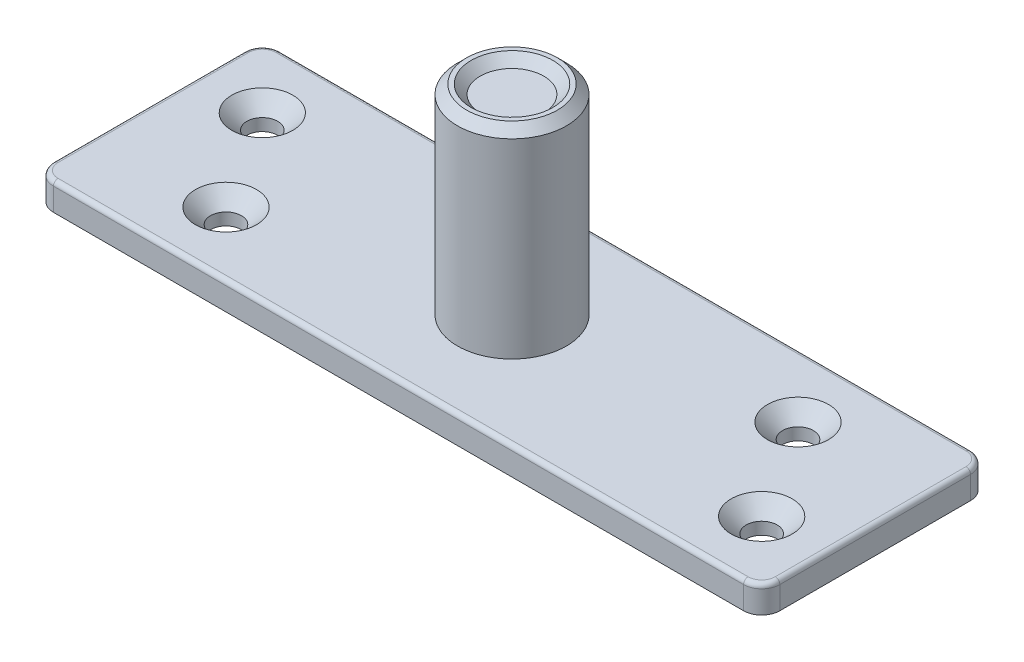
from build123d import *

# Parameters (mm, degrees)
ESBO_O1_W                           = 80
ESBO_O1_H                           = 25
ESBO_O1_R                           = 6
RESSALTO_EXTRUS_O1_DEPTH            = 1.5
ESBO_O3_R                           = 6
RESSALTO_EXTRUS_O3_DEPTH            = 25
CHANFRO1_SIZE                       = 1
ESCAREADO_PARA_SFHCS_M31_AT_2_COUNT = 2
ESCAREADO_PARA_SFHCS_M31_AT_2_PITCH = 13.03840481
ESCAREADO_PARA_SFHCS_M31_AT_3_COUNT = 2
ESCAREADO_PARA_SFHCS_M31_AT_3_PITCH = 59
ESCAREADO_PARA_SFHCS_M31_AT_4_COUNT = 2
ESCAREADO_PARA_SFHCS_M31_AT_4_PITCH = 66.910387833
FILETE1_R                           = 2
FILETE2_R                           = 0.5
ESBO_O7_R                           = 4.5
CORTE_EXTRUS_O1_DEPTH               = 1
CHANFRO2_SIZE                       = 1


with BuildPart() as part:
    # Esboço1 → Ressalto-extrusão1 (new, symmetric)
    with BuildSketch(Plane(origin=(0, 0, 0), x_dir=(1, 0, 0), z_dir=(0, 1, 0))):
        Rectangle(ESBO_O1_W, ESBO_O1_H)
        with Locations(Location((0, 0, 0), (0, 0, 270))):
            Circle(ESBO_O1_R, mode=Mode.SUBTRACT)
    extrude(amount=RESSALTO_EXTRUS_O1_DEPTH, both=True)

    # Esboço6 → Escareado para SFHCS M31 (revolve, cut)
    with BuildSketch(Plane(origin=(-33, 1.5, -5.5), x_dir=(0, 0, 1), z_dir=(1, 0, 0))):
        Polygon((0, 0), (0, 3), (1.7, 3), (1.7, 1.66), (3.36, 0), align=None)
    escareado_para_sfhcs_m31 = revolve(axis=Axis((-33, 7.85, -5.5), (0, -1, 0)), mode=Mode.SUBTRACT)

    # Escareado para SFHCS M31 at 2: Escareado para SFHCS M31 ×2
    with Locations(*[Vector(0.5368754921931594, 0, 0.8436614877321075) * (i * ESCAREADO_PARA_SFHCS_M31_AT_2_PITCH) for i in range(1, ESCAREADO_PARA_SFHCS_M31_AT_2_COUNT)]):
        add(escareado_para_sfhcs_m31, mode=Mode.SUBTRACT)

    # Escareado para SFHCS M31 at 3: Escareado para SFHCS M31 ×2
    with Locations(*[(i * ESCAREADO_PARA_SFHCS_M31_AT_3_PITCH, 0, 0) for i in range(1, ESCAREADO_PARA_SFHCS_M31_AT_3_COUNT)]):
        add(escareado_para_sfhcs_m31, mode=Mode.SUBTRACT)

    # Escareado para SFHCS M31 at 4: Escareado para SFHCS M31 ×2
    with Locations(*[Vector(0.9863939238321439, 0, 0.16439898730535732) * (i * ESCAREADO_PARA_SFHCS_M31_AT_4_PITCH) for i in range(1, ESCAREADO_PARA_SFHCS_M31_AT_4_COUNT)]):
        add(escareado_para_sfhcs_m31, mode=Mode.SUBTRACT)

    # Filete1
    filete1_edges = [part.edges().sort_by_distance(p)[0] for p in [
        (40, 0, 12.5),
        (-40, 0, 12.5),
        (-40, 0, -12.5),
        (40, 0, -12.5),
    ]]
    fillet(filete1_edges, radius=FILETE1_R)

    # Filete2
    filete2_edges = [part.edges().sort_by_distance(p)[0] for p in [
        (0, 1.5, -12.5),
        (40, 1.5, 0),
        (-40, 1.5, 0),
        (0, 1.5, 12.5),
        (-39.414213562, 1.5, 11.914213562),
        (-39.414213562, 1.5, -11.914213562),
        (39.414213562, 1.5, 11.914213562),
        (39.414213562, 1.5, -11.914213562),
    ]]
    fillet(filete2_edges, radius=FILETE2_R)


with BuildPart() as body_2:
    # Esboço3 → Ressalto-extrusão3 (new body)
    with BuildSketch(Plane.XZ.offset(1.5)):
        with Locations(Location((0, 0, 0), (0, 0, 270))):
            Circle(ESBO_O3_R)
    extrude(amount=-RESSALTO_EXTRUS_O3_DEPTH)

    # Chanfro1
    chanfro1_edges = [body_2.edges().sort_by_distance(p)[0] for p in [
        (0, -1.5, 6),
        (0, 23.5, 6),
    ]]
    chamfer(chanfro1_edges, length=CHANFRO1_SIZE)

    # Esboço7 → Corte-extrusão1 (cut)
    with BuildSketch(Plane(origin=(0, 23.5, 0), x_dir=(1, 0, 0), z_dir=(0, 1, 0))):
        with Locations(Location((0, 0, 0), (0, 0, 270))):
            Circle(ESBO_O7_R)
    extrude(amount=-CORTE_EXTRUS_O1_DEPTH, mode=Mode.SUBTRACT)

    # Chanfro2
    chanfro2_edges = [body_2.edges().sort_by_distance(p)[0] for p in [
        (0, 22.5, -4.5),
    ]]
    chamfer(chanfro2_edges, length=CHANFRO2_SIZE - 0.0001)  # a hair under: the kernel refuses the full size


solid = Compound([part.part, body_2.part])
